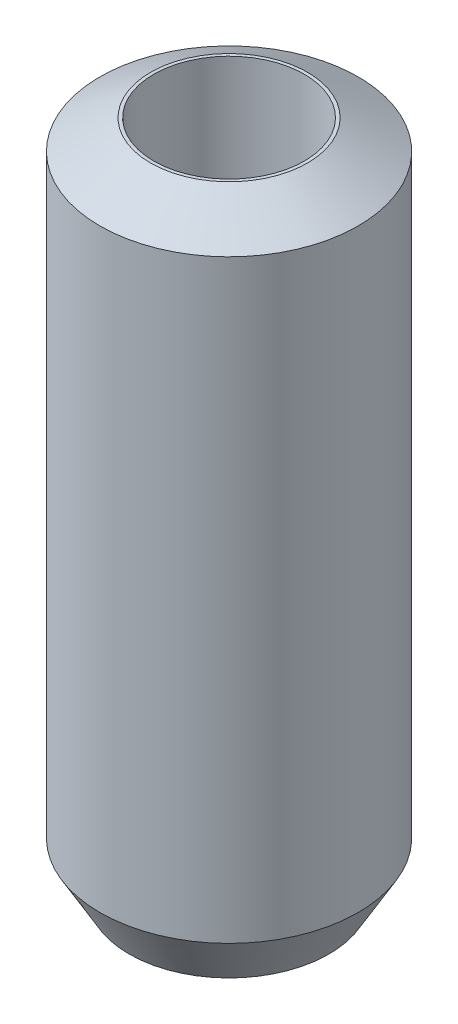
from build123d import *
from OCP.BRepFilletAPI import BRepFilletAPI_MakeChamfer

# Parameters (mm, degrees)
SKETCH1_R           = 12.5
BOSS_EXTRUDE1_DEPTH = 65.275574103
SKETCH2_R           = 7.286518786
CUT_EXTRUDE1_DEPTH  = 68.626921965
CHAMFER1_SIZE       = 2.827436399
CHAMFER1_SIZE2      = 4.897263498


with BuildPart() as part:
    # Sketch1 → Boss-Extrude1 (new body)
    with BuildSketch(Plane(origin=(0, 0, 0), x_dir=(1, 0, 0), z_dir=(0, 1, 0))):
        Circle(SKETCH1_R)
    extrude(amount=BOSS_EXTRUDE1_DEPTH)

    # Sketch2 → Cut-Extrude1 (cut, through all)
    with BuildSketch(Plane(origin=(0, 0, 0), x_dir=(1, 0, 0), z_dir=(0, 1, 0))):
        Circle(SKETCH2_R)
    extrude(amount=CUT_EXTRUDE1_DEPTH, mode=Mode.SUBTRACT)

    # Chamfer1: one chamfer whose edges measure the first distance from different faces: ONE call of the kernel's chamfer builder (chamfer() names one face for all edges)
    chamfer1_edges_1 = [part.edges().sort_by_distance(p)[0] for p in [
        (-12.5, 65.275574103, 0),
    ]]
    chamfer1_side_1 = [part.faces().sort_by_distance(p)[0] for p in [
        (-12.5, 32.637787052, 0),
    ]]
    chamfer1_edges_2 = [part.edges().sort_by_distance(p)[0] for p in [
        (-12.5, 0, 0),
    ]]
    chamfer1_side_2 = [part.faces().sort_by_distance(p)[0] for p in [
        (-12.146446609, 0, 0),
    ]]
    chamfer1 = BRepFilletAPI_MakeChamfer(part.part.solid().wrapped)
    for e in chamfer1_edges_1:
        chamfer1.Add(CHAMFER1_SIZE, CHAMFER1_SIZE2, e.wrapped, chamfer1_side_1[0].wrapped)  # the first distance lies on this face
    for e in chamfer1_edges_2:
        chamfer1.Add(CHAMFER1_SIZE, CHAMFER1_SIZE2, e.wrapped, chamfer1_side_2[0].wrapped)  # the first distance lies on this face
    add(Compound.cast(chamfer1.Shape()), mode=Mode.REPLACE)


solid = part.part
